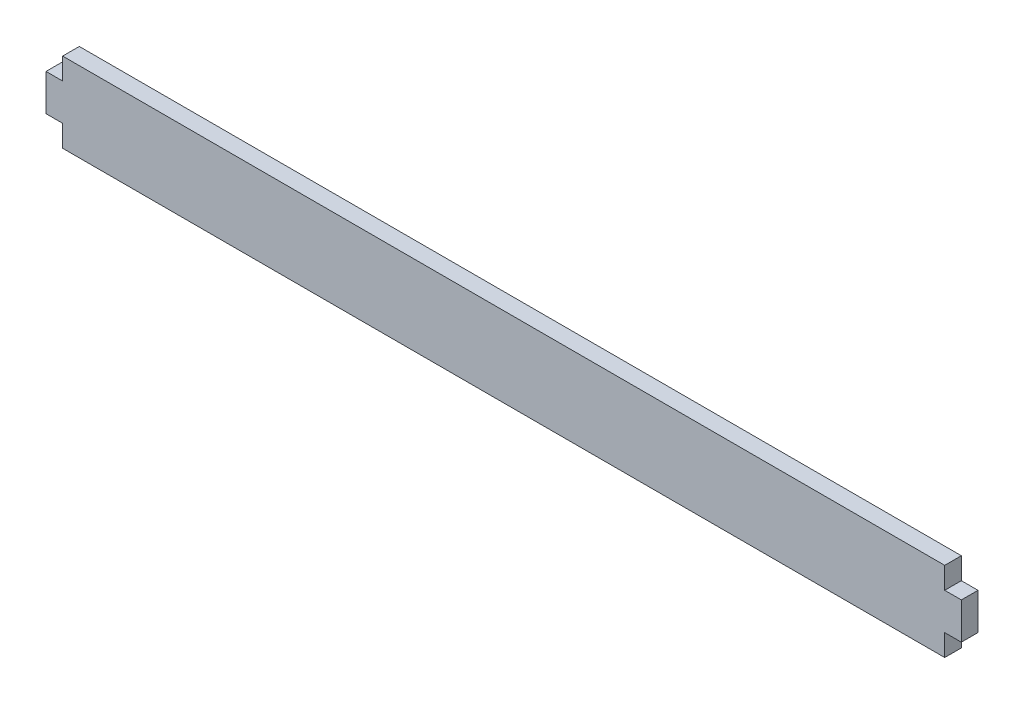
from build123d import *

# Parameters (mm, degrees)
SKETCH1_W             = 550
SKETCH1_H             = 48
EXTRUDE_271_DEPTH     = 10
CUT_EXTRUDE_536_REACH = 278.226
SKETCH2_W             = 10
SKETCH2_H             = 13


with BuildPart() as part:
    # Sketch1 → Extrude 271 (new body)
    with BuildSketch(Plane.XY):
        Rectangle(SKETCH1_W, SKETCH1_H)
    extrude(amount=EXTRUDE_271_DEPTH)

    # Sketch2 → Cut-Extrude 536 (cut, up to next)
    with BuildSketch(Plane.XY.offset(10), mode=Mode.PRIVATE) as cut_extrude_536_sk1:
        with Locations((-270, -17.5)):
            Rectangle(SKETCH2_W, SKETCH2_H)
    cut_extrude_536_tool1 = extrude(cut_extrude_536_sk1.sketch, amount=-CUT_EXTRUDE_536_REACH, mode=Mode.PRIVATE) & part.part
    # Sketch2 → Cut-Extrude 536 (cut, up to next)
    with BuildSketch(Plane.XY.offset(10), mode=Mode.PRIVATE) as cut_extrude_536_sk2:
        with Locations((-270, 17.5)):
            Rectangle(SKETCH2_W, SKETCH2_H)
    cut_extrude_536_tool2 = extrude(cut_extrude_536_sk2.sketch, amount=-CUT_EXTRUDE_536_REACH, mode=Mode.PRIVATE) & part.part
    cut_extrude_536_1 = cut_extrude_536_tool1.solids().sort_by_distance((-270, -17.5, 10))[0]
    add(cut_extrude_536_1, mode=Mode.SUBTRACT)
    cut_extrude_536_2 = cut_extrude_536_tool2.solids().sort_by_distance((-270, 17.5, 10))[0]
    add(cut_extrude_536_2, mode=Mode.SUBTRACT)
    cut_extrude_536 = cut_extrude_536_1 + cut_extrude_536_2  # Cut-Extrude 536 as one shape, for the pattern or mirror that repeats it

    # Mirror1: Cut-Extrude 536 across plane
    add(cut_extrude_536.mirror(Plane(origin=(0, 0, 0), x_dir=(0, 0, 1), z_dir=(1, 0, 0))), mode=Mode.SUBTRACT)


solid = part.part
